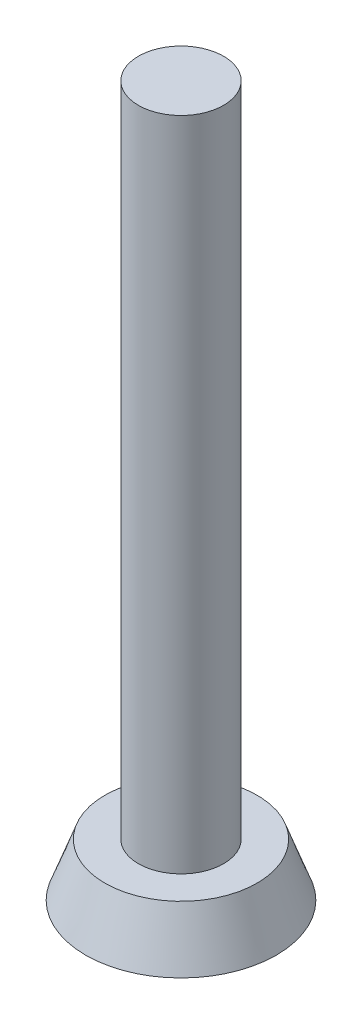
from build123d import *

# Parameters (mm, degrees)
SKETCH1_R           = 3.36
BOSS_EXTRUDE1_DEPTH = 1.86
BOSS_EXTRUDE1_TAPER = 20
SKETCH2_R           = 1.5
BOSS_EXTRUDE2_DEPTH = 23.14
CUT_EXTRUDE1_DEPTH  = 1.5


with BuildPart() as part:
    # Sketch1 → Boss-Extrude1 (new body)
    with BuildSketch(Plane(origin=(0, 0, 0), x_dir=(1, 0, 0), z_dir=(0, 1, 0))):
        Circle(SKETCH1_R)
    extrude(amount=BOSS_EXTRUDE1_DEPTH, taper=BOSS_EXTRUDE1_TAPER)

    # Sketch2 → Boss-Extrude2 (add)
    with BuildSketch(Plane(origin=(0, 1.86, 0), x_dir=(1, 0, 0), z_dir=(0, 1, 0))):
        Circle(SKETCH2_R)
    extrude(amount=BOSS_EXTRUDE2_DEPTH)

    # Sketch3 → Cut-Extrude1 (cut)
    with BuildSketch(Plane.XZ):
        Polygon((0, 1.154700538), (-1, 0.577350269), (-1, -0.577350269), (0, -1.154700538), (1, -0.577350269), (1, 0.577350269), align=None)
    extrude(amount=-CUT_EXTRUDE1_DEPTH, mode=Mode.SUBTRACT)


solid = part.part
